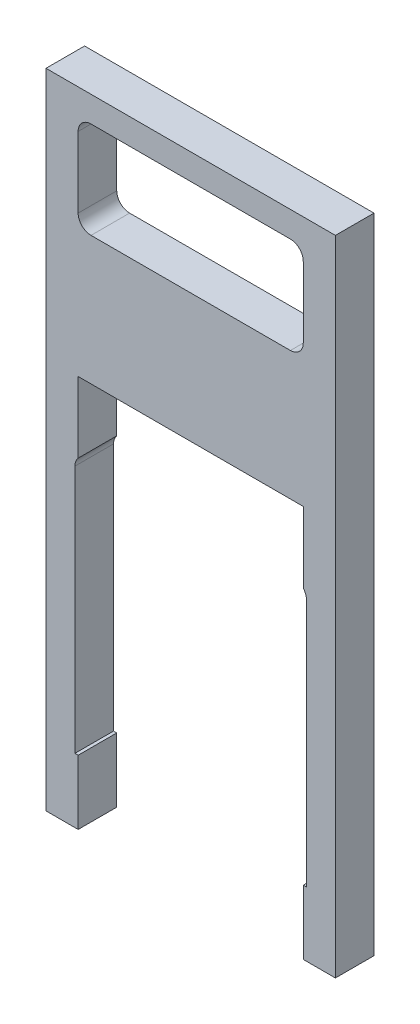
from build123d import *

# Parameters (mm, degrees)
SKETCH1_W           = 57.15
SKETCH1_H           = 127
BOSS_EXTRUDE1_DEPTH = 7.62
SKETCH2_W           = 44.45
SKETCH2_H           = 121.92
CUT_EXTRUDE1_DEPTH  = 71.048875972
SKETCH4_W           = 45.72
SKETCH4_H           = 50.8
CUT_EXTRUDE2_DEPTH  = 71.048875972
SKETCH5_W           = 44.45
SKETCH5_H           = 25.4
BOSS_EXTRUDE2_DEPTH = 7.62
FILLET1_R           = 2.54


with BuildPart() as part:
    # Sketch1 → Boss-Extrude1 (new body)
    with BuildSketch(Plane.XY):
        Rectangle(SKETCH1_W, SKETCH1_H)
    extrude(amount=BOSS_EXTRUDE1_DEPTH)

    # Sketch2 → Cut-Extrude1 (cut, through all)
    with BuildSketch(Plane.XY.offset(7.62)):
        with Locations((0, -2.54)):
            Rectangle(SKETCH2_W, SKETCH2_H)
    extrude(amount=-CUT_EXTRUDE1_DEPTH, mode=Mode.SUBTRACT)

    # Sketch4 → Cut-Extrude2 (cut, through all)
    with BuildSketch(Plane.XY.offset(7.62)):
        with Locations((0, -25.4)):
            Rectangle(SKETCH4_W, SKETCH4_H)
    extrude(amount=-CUT_EXTRUDE2_DEPTH, mode=Mode.SUBTRACT)

    # Sketch5 → Boss-Extrude2 (add)
    with BuildSketch(Plane.XY.offset(7.62)):
        with Locations((0, 26.67)):
            Rectangle(SKETCH5_W, SKETCH5_H)
    extrude(amount=-BOSS_EXTRUDE2_DEPTH)

    # Fillet1
    # the kernel refuses this fillet: 2.54 mm, written as the material it adds along each edge
    with BuildSketch(Plane(origin=(-22.225, 58.42, 7.62), x_dir=(1, 0, 0), z_dir=(0, 0, -1)), Plane(origin=(22.225, 58.42, 7.62), x_dir=(0, -1, 0), z_dir=(0, 0, -1)), Plane(origin=(-22.225, 39.37, 7.62), x_dir=(0, 1, 0), z_dir=(0, 0, -1))) as fillet1_piece_1:
        with BuildLine():
            CenterArc((FILLET1_R, FILLET1_R), FILLET1_R, 180, 90)
            Line((0, FILLET1_R), (-FILLET1_R * 0.02, FILLET1_R))
            Line((-FILLET1_R * 0.02, FILLET1_R), (-FILLET1_R * 0.02, -FILLET1_R * 0.02))
            Line((-FILLET1_R * 0.02, -FILLET1_R * 0.02), (FILLET1_R, -FILLET1_R * 0.02))
            Line((FILLET1_R, -FILLET1_R * 0.02), (FILLET1_R, 0))
        make_face()
    extrude(amount=7.62)
    with BuildSketch(Plane(origin=(22.86, 0, 7.62), x_dir=(0, -1, 0), z_dir=(0, 0, -1))) as fillet1_piece_2:
        with BuildLine():
            CenterArc((1.680052083, 2.54), FILLET1_R, 228.590377891, 41.409622109)
            Line((0, 0.635), (-0.033601042, 0.5969))
            ThreePointArc((-0.033601042, 0.5969), (-0.0508, 0.3175), (-0.0508, 0))
            Line((-0.0508, 0), (0, -0.0508))
            Line((0, -0.0508), (1.680052083, -0.0508))
            Line((1.680052083, -0.0508), (1.680052083, 0))
        make_face()
    extrude(amount=7.62)
    with BuildSketch(Plane(origin=(-22.86, 0, 7.62), x_dir=(1, 0, 0), z_dir=(0, 0, -1))) as fillet1_piece_3:
        with BuildLine():
            CenterArc((2.54, 1.680052083), FILLET1_R, 180, 41.409622109)
            Line((0, 1.680052083), (-0.0508, 1.680052083))
            Line((-0.0508, 1.680052083), (-0.0508, 0))
            Line((-0.0508, 0), (0, -0.0508))
            ThreePointArc((0, -0.0508), (0.3175, -0.0508), (0.5969, -0.033601042))
            Line((0.5969, -0.033601042), (0.635, 0))
        make_face()
    extrude(amount=7.62)
    with BuildSketch(Plane(origin=(22.225, 39.37, 7.62), x_dir=(0, 1, 0), z_dir=(0, 0, -1))) as fillet1_piece_4:
        with BuildLine():
            CenterArc((FILLET1_R, -FILLET1_R), FILLET1_R, 90, 90)
            Line((0, -FILLET1_R), (-FILLET1_R * 0.02, -FILLET1_R))
            Line((-FILLET1_R * 0.02, -FILLET1_R), (-FILLET1_R * 0.02, FILLET1_R * 0.02))
            Line((-FILLET1_R * 0.02, FILLET1_R * 0.02), (FILLET1_R, FILLET1_R * 0.02))
            Line((FILLET1_R, FILLET1_R * 0.02), (FILLET1_R, 0))
        make_face()
    extrude(amount=7.62)


solid = part.part
